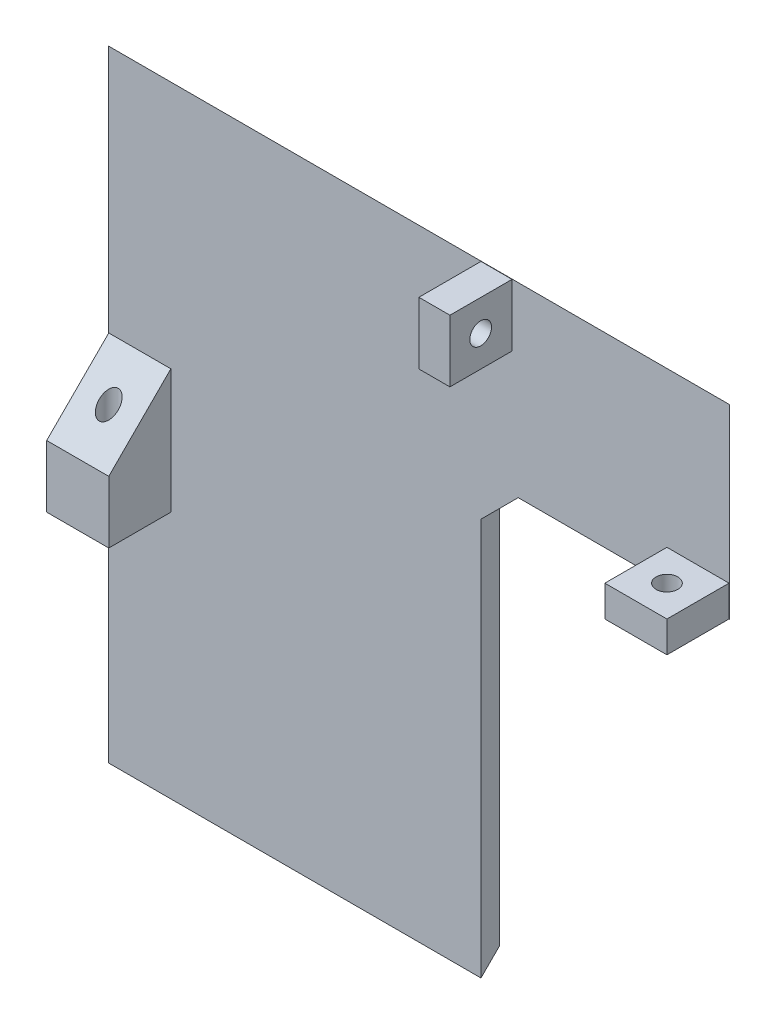
from build123d import *

# Parameters (mm, degrees)
ESQUISSE1_W             = 100
ESQUISSE1_H             = 100
BOSS_EXTRU_1_DEPTH      = 3
ESQUISSE2_W             = 10
ESQUISSE2_H             = 20
BOSS_EXTRU_2_DEPTH      = 10
CHANFREIN1_SIZE         = 10
ESQUISSE3_R             = 1.525
ENL_V_MAT_EXTRU_1_DEPTH = 118.3413823
CHANFREIN2_SIZE         = 3
ESQUISSE4_W             = 5
ESQUISSE4_H             = 10
BOSS_EXTRU_3_DEPTH      = 10
ESQUISSE5_R             = 1.75
ENL_V_MAT_EXTRU_2_DEPTH = 10
ESQUISSE6_W             = 55.202992824
ESQUISSE6_H             = 76.399934011
ENL_V_MAT_EXTRU_3_DEPTH = 10
ESQUISSE9_W             = 10
ESQUISSE9_H             = 5
BOSS_EXTRU_5_DEPTH      = 10
ESQUISSE10_R            = 1.75
ENL_V_MAT_EXTRU_5_DEPTH = 10
CHANFREIN3_SIZE         = 6


with BuildPart() as part:
    # Esquisse1 → Boss.-Extru.1 (new body)
    with BuildSketch(Plane.XY):
        with Locations((50, 50)):
            Rectangle(ESQUISSE1_W, ESQUISSE1_H)
    extrude(amount=BOSS_EXTRU_1_DEPTH)

    # Esquisse2 → Boss.-Extru.2 (add)
    with BuildSketch(Plane.XY.offset(3)):
        with Locations((5.05, 50)):
            Rectangle(ESQUISSE2_W, ESQUISSE2_H)
        with Locations((94.95, 50)):
            Rectangle(ESQUISSE2_W, ESQUISSE2_H)
    extrude(amount=BOSS_EXTRU_2_DEPTH)

    # Chanfrein1
    chanfrein1_edges = [part.edges().sort_by_distance(p)[0] for p in [
        (94.95, 60, 13),
        (5.05, 60, 13),
    ]]
    chamfer(chanfrein1_edges, length=CHANFREIN1_SIZE - 0.0001)  # a hair under: the kernel refuses the full size

    # Esquisse3 → Enlèv. mat.-Extru.1 (cut, through all)
    with BuildSketch(Plane.XZ.offset(-40)):
        with Locations(Location((5.046227865, 8, 0), (0, 0, 270))):
            Circle(ESQUISSE3_R)
        with Locations(Location((94.95, 8, 0), (0, 0, 270))):
            Circle(ESQUISSE3_R)
    extrude(amount=-ENL_V_MAT_EXTRU_1_DEPTH, mode=Mode.SUBTRACT)

    # Chanfrein2
    chanfrein2_edges = [part.edges().sort_by_distance(p)[0] for p in [
        (50, 0, 0),
        (100, 50, 0),
        (50, 100, 0),
        (0, 50, 0),
    ]]
    chamfer(chanfrein2_edges, length=CHANFREIN2_SIZE - 0.0001)  # a hair under: the kernel refuses the full size

    # Esquisse4 → Boss.-Extru.3 (add)
    with BuildSketch(Plane.XY.offset(3)):
        with Locations((62.5, 94.95)):
            Rectangle(ESQUISSE4_W, ESQUISSE4_H)
    extrude(amount=BOSS_EXTRU_3_DEPTH)

    # Esquisse5 → Enlèv. mat.-Extru.2 (cut)
    with BuildSketch(Plane(origin=(65, 0, 0), x_dir=(0, 0, -1), z_dir=(1, 0, 0))):
        with Locations((-8.05, 94.95)):
            Circle(ESQUISSE5_R)
    extrude(amount=-ENL_V_MAT_EXTRU_2_DEPTH, mode=Mode.SUBTRACT)

    # Esquisse6 → Enlèv. mat.-Extru.3 (cut)
    with BuildSketch(Plane.XY.offset(3)):
        with Locations((87.601496412, 31.800032995)):
            Rectangle(ESQUISSE6_W, ESQUISSE6_H)
    extrude(amount=-ENL_V_MAT_EXTRU_3_DEPTH, mode=Mode.SUBTRACT)


with BuildPart() as body_2:
    # of the pieces the cut leaves, the one that is kept (enl_v_mat_extru_3_keep)
    add(part.part.solids().sort_by_distance((0, 100, 2.9999))[0])

    # Esquisse9 → Boss.-Extru.5 (add)
    with BuildSketch(Plane.XY.offset(3)):
        with Locations((94.95, 72.55)):
            Rectangle(ESQUISSE9_W, ESQUISSE9_H)
    extrude(amount=BOSS_EXTRU_5_DEPTH)

    # Esquisse10 → Enlèv. mat.-Extru.5 (cut)
    with BuildSketch(Plane.XZ.offset(-70)):
        with Locations(Location((94.95, 8, 0), (0, 0, 270))):
            Circle(ESQUISSE10_R)
    extrude(amount=-ENL_V_MAT_EXTRU_5_DEPTH, mode=Mode.SUBTRACT)

    # Chanfrein3
    chanfrein3_edges = [body_2.edges().sort_by_distance(p)[0] for p in [
        (60, 70, 1.5),
    ]]
    chamfer(chanfrein3_edges, length=CHANFREIN3_SIZE)


solid = body_2.part
